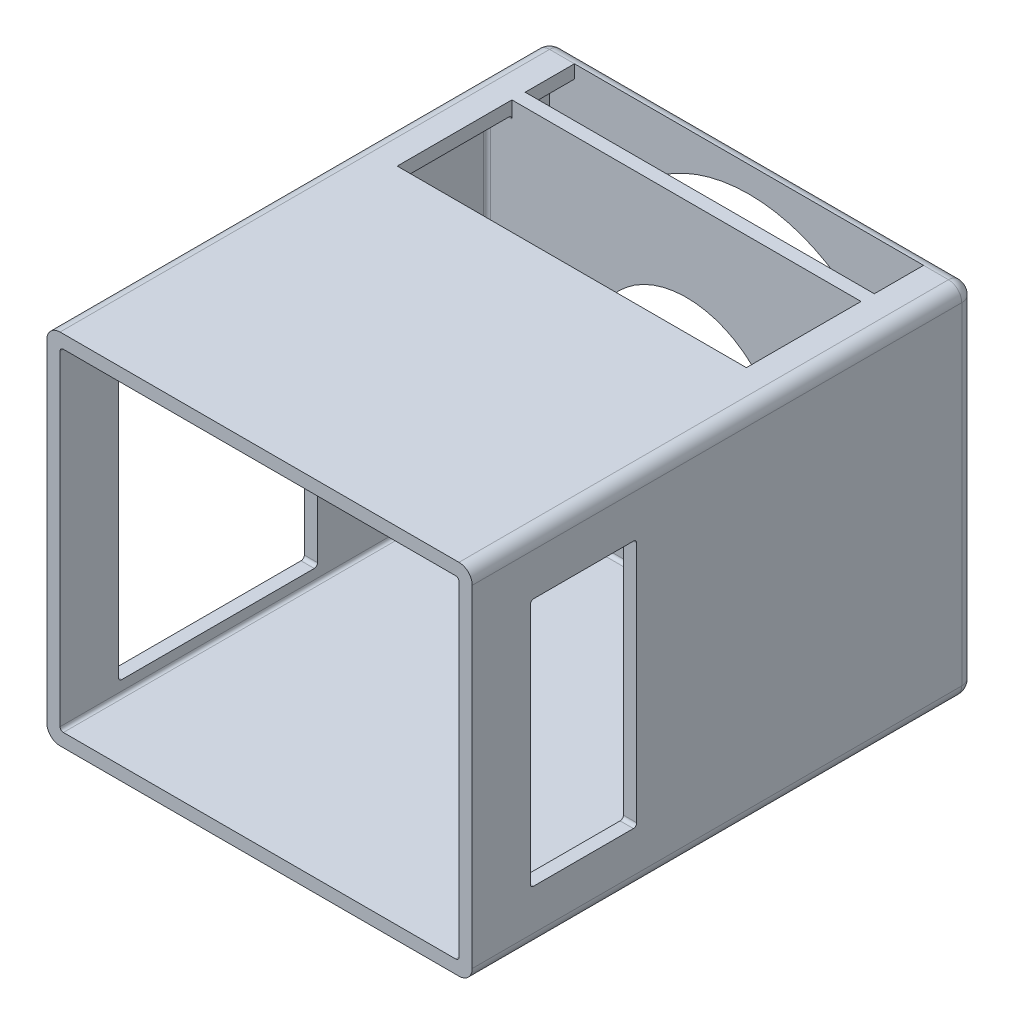
from build123d import *

# Parameters (mm, degrees)
BOSS_EXTRUDE1_DEPTH = 216
SKETCH3_W           = 240.4
SKETCH3_H           = 260
BOSS_EXTRUDE2_DEPTH = 8
SKETCH4_R           = 100
CUT_EXTRUDE1_DEPTH  = 8
CUT_EXTRUDE1_DRAFT  = -42.88487357
SKETCH6_W           = 240.4
SKETCH6_H           = 208
BOSS_EXTRUDE3_DEPTH = 8
SKETCH7_R           = 64.93911957
CUT_EXTRUDE2_DEPTH  = 8
CUT_EXTRUDE2_DRAFT  = -42.88487357
SKETCH8_W           = 70.3
SKETCH8_H           = 200
CUT_EXTRUDE3_DEPTH  = 8
SKETCH9_W           = 256.4
SKETCH9_H           = 216
SKETCH9_W_2         = 240.4
SKETCH9_H_2         = 200
BOSS_EXTRUDE4_DEPTH = 35.2
SKETCH12_W          = 240.4
SKETCH12_H          = 153.003510621
BOSS_EXTRUDE6_DEPTH = 8
SKETCH13_W          = 64.11038507
SKETCH13_H          = 150
CUT_EXTRUDE6_DEPTH  = 8
SKETCH15_W          = 49.9
SKETCH15_H          = 184
CUT_EXTRUDE8_DEPTH  = 8
SKETCH16_W          = 70.2
SKETCH16_H          = 8
SKETCH16_W_2        = 70.1
BOSS_EXTRUDE7_DEPTH = 8
SKETCH19_W          = 15
SKETCH19_H          = 106.796489379
BOSS_EXTRUDE8_DEPTH = 8
FILLET2_R           = 8
FILLET3_R           = 2
FILLET4_R           = 2
FILLET5_R           = 2
SKETCH20_W          = 29
SKETCH20_H          = 30
CUT_EXTRUDE9_DEPTH  = 10
FILLET6_R           = 2


with BuildPart() as part:
    # Sketch2 → Boss-Extrude1 (new body)
    with BuildSketch(Plane(origin=(0, 0, 0), x_dir=(1, 0, 0), z_dir=(0, 1, 0))):
        Polygon((256.4, 0), (248.4, 0), (248.4, 260), (8, 260), (8, 0), (0, 0), (0, 268), (256.4, 268), align=None)
    extrude(amount=BOSS_EXTRUDE1_DEPTH)

    # Sketch3 → Boss-Extrude2 (add)
    with BuildSketch(Plane.XZ):
        with Locations((128.2, -130)):
            Rectangle(SKETCH3_W, SKETCH3_H)
    extrude(amount=-BOSS_EXTRUDE2_DEPTH)


with BuildPart() as cut_extrude1_tool:
    # Sketch4 → Cut-Extrude1 (with draft: the straight prism first)
    with BuildSketch(Plane(origin=(0, 0, -268), x_dir=(-1, 0, 0), z_dir=(0, 0, -1))):
        with Locations((-128.2, 108)):
            Circle(SKETCH4_R)
    extrude(amount=-CUT_EXTRUDE1_DEPTH)
    # Cut-Extrude1: the draft: its side faces are tilted about the plane it starts from
    cut_extrude1_sides = [cut_extrude1_tool.faces().sort_by_distance(p)[0] for p in [
        (228.2, 108, -264),
    ]]
    draft(cut_extrude1_sides, Plane(origin=(0, 0, -268), x_dir=(-1, 0, 0), z_dir=(0, 0, -1)), CUT_EXTRUDE1_DRAFT)


with BuildPart() as part_1:
    add(part.part)

    # Cut-Extrude1: cut by cut_extrude1_tool
    add(cut_extrude1_tool.part, mode=Mode.SUBTRACT)

    # Sketch6 → Boss-Extrude3 (add)
    with BuildSketch(Plane.XY.offset(-230.3)):
        with Locations((128.2, 112)):
            Rectangle(SKETCH6_W, SKETCH6_H)
    extrude(amount=BOSS_EXTRUDE3_DEPTH)


with BuildPart() as cut_extrude2_tool:
    # Sketch7 → Cut-Extrude2 (with draft: the straight prism first)
    with BuildSketch(Plane(origin=(0, 0, -230.3), x_dir=(-1, 0, 0), z_dir=(0, 0, -1))):
        with Locations((-128.2, 108)):
            Circle(SKETCH7_R)
    extrude(amount=-CUT_EXTRUDE2_DEPTH)
    # Cut-Extrude2: the draft: its side faces are tilted about the plane it starts from
    cut_extrude2_sides = [cut_extrude2_tool.faces().sort_by_distance(p)[0] for p in [
        (193.13911957, 108, -226.3),
    ]]
    draft(cut_extrude2_sides, Plane(origin=(0, 0, -230.3), x_dir=(-1, 0, 0), z_dir=(0, 0, -1)), CUT_EXTRUDE2_DRAFT)


with BuildPart() as part_2:
    add(part_1.part)

    # Cut-Extrude2: cut by cut_extrude2_tool
    add(cut_extrude2_tool.part, mode=Mode.SUBTRACT)

    # Sketch8 → Cut-Extrude3 (cut)
    with BuildSketch(Plane.ZY):
        with Locations((-35.15, 108)):
            Rectangle(SKETCH8_W, SKETCH8_H)
    extrude(amount=-CUT_EXTRUDE3_DEPTH, mode=Mode.SUBTRACT)

    # Sketch9 → Boss-Extrude4 (add)
    with BuildSketch(Plane.XY.offset(35)):
        with Locations((128.2, 108)):
            Rectangle(SKETCH9_W, SKETCH9_H)
        with Locations((128.2, 108)):
            Rectangle(SKETCH9_W_2, SKETCH9_H_2, mode=Mode.SUBTRACT)
    extrude(amount=-BOSS_EXTRUDE4_DEPTH)

    # Sketch12 → Boss-Extrude6 (add)
    with BuildSketch(Plane(origin=(0, 216, 0), x_dir=(1, 0, 0), z_dir=(0, 1, 0))):
        with Locations((128.2, 76.701755311)):
            Rectangle(SKETCH12_W, SKETCH12_H)
    extrude(amount=-BOSS_EXTRUDE6_DEPTH)

    # Sketch13 → Cut-Extrude6 (cut)
    with BuildSketch(Plane(origin=(256.4, 0, 0), x_dir=(0, 0, -1), z_dir=(1, 0, 0))):
        with Locations((32.055192535, 107.5)):
            Rectangle(SKETCH13_W, SKETCH13_H)
    extrude(amount=-CUT_EXTRUDE6_DEPTH, mode=Mode.SUBTRACT)

    # Sketch15 → Cut-Extrude8 (cut)
    with BuildSketch(Plane.ZY):
        with Locations((-95.25, 108)):
            Rectangle(SKETCH15_W, SKETCH15_H)
    extrude(amount=-CUT_EXTRUDE8_DEPTH, mode=Mode.SUBTRACT)

    # Sketch16 → Boss-Extrude7 (add)
    with BuildSketch(Plane.ZY):
        with Locations((-35.2, 12)):
            Rectangle(SKETCH16_W, SKETCH16_H)
        with Locations((-35.25, 204)):
            Rectangle(SKETCH16_W_2, SKETCH16_H)
    extrude(amount=-BOSS_EXTRUDE7_DEPTH)

    # Sketch19 → Boss-Extrude8 (add)
    with BuildSketch(Plane(origin=(0, 216, 0), x_dir=(1, 0, 0), z_dir=(0, 1, 0))):
        with Locations((15.5, 206.601755311)):
            Rectangle(SKETCH19_W, SKETCH19_H)
        with Locations((240.9, 206.601755311)):
            Rectangle(SKETCH19_W, SKETCH19_H)
    extrude(amount=-BOSS_EXTRUDE8_DEPTH)

    # Fillet2
    fillet2_edges = [part_2.edges().sort_by_distance(p)[0] for p in [
        (0, 0, -116.5),
        (0, 108, -268),
        (256.4, 108, -268),
        (256.4, 216, -116.5),
        (128.2, 216, -268),
        (0, 216, -116.5),
        (128.2, 0, -268),
        (256.4, 0, -116.5),
    ]]
    fillet(fillet2_edges, radius=FILLET2_R - 0.0001)  # a hair under: the kernel refuses the full size

    # Fillet3
    fillet3_edges = [part_2.edges().sort_by_distance(p)[0] for p in [
        (8, 208, -93.65),
        (248.4, 208, -93.65),
        (248.4, 8, -93.65),
        (8, 8, -93.65),
    ]]
    fillet(fillet3_edges, radius=FILLET3_R)

    # Fillet4
    fillet4_edges = [part_2.edges().sort_by_distance(p)[0] for p in [
        (16.5, 208, -222.3),
        (239.9, 208, -222.3),
        (248.4, 108, -222.3),
        (128.2, 8, -222.3),
        (8, 108, -222.3),
        (8.585786438, 207.414213562, -222.3),
        (247.814213562, 207.414213562, -222.3),
        (8.585786438, 8.585786438, -222.3),
        (247.814213562, 8.585786438, -222.3),
    ]]
    fillet(fillet4_edges, radius=FILLET4_R)

    # Fillet5
    fillet5_edges = [part_2.edges().sort_by_distance(p)[0] for p in [
        (252.4, 32.5, 0),
        (252.4, 182.5, 0),
        (252.4, 182.5, -64.11038507),
        (252.4, 32.5, -64.11038507),
        (4, 16, -120.2),
        (4, 200, -120.2),
        (4, 16, -0.2),
        (4, 200, -0.2),
    ]]
    fillet(fillet5_edges, radius=FILLET5_R)

    # Sketch20 → Cut-Extrude9 (cut)
    with BuildSketch(Plane.ZY):
        with Locations((-166.055192535, 107.75)):
            Rectangle(SKETCH20_W, SKETCH20_H)
    extrude(amount=-CUT_EXTRUDE9_DEPTH, mode=Mode.SUBTRACT)

    # Fillet6
    fillet6_edges = [part_2.edges().sort_by_distance(p)[0] for p in [
        (4, 122.75, -151.555192535),
        (4, 92.75, -151.555192535),
        (4, 92.75, -180.555192535),
        (4, 122.75, -180.555192535),
    ]]
    fillet(fillet6_edges, radius=FILLET6_R)


solid = part_2.part
